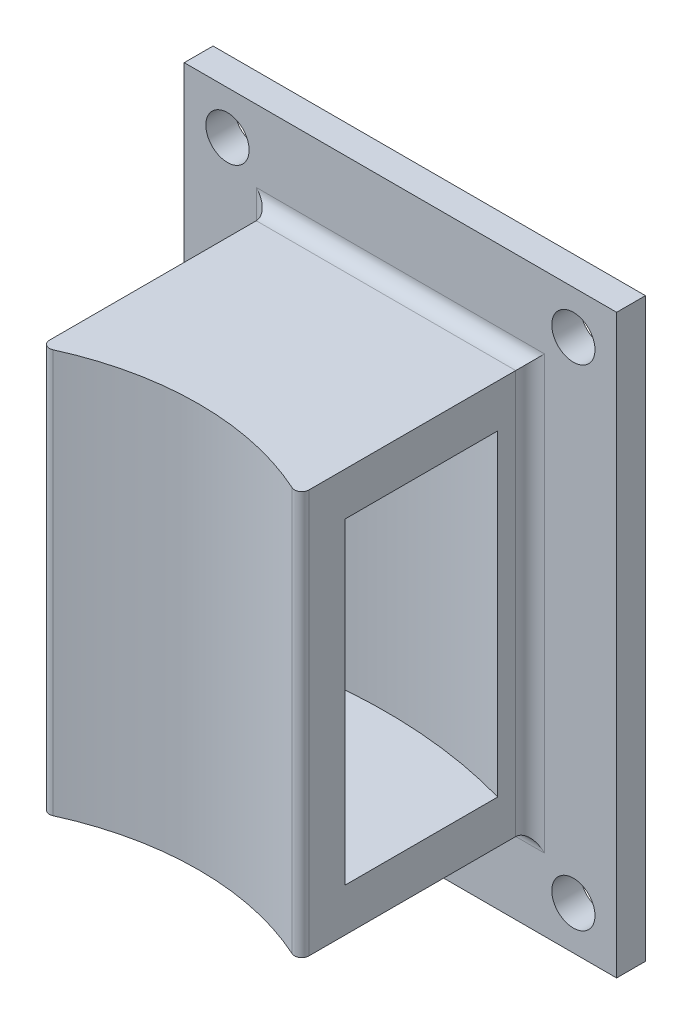
from build123d import *

# Parameters (mm, degrees)
EXTRUDE_1_DEPTH     = 11
EXTRUDE_1_2_DEPTH   = 11
EXTRUDE_2_DEPTH     = 3
SKETCH_5_W          = 30
SKETCH_5_H          = 40
SKETCH_5_W_2        = 18
SKETCH_5_H_2        = 28
EXTRUDE_3_DEPTH     = 2
SKETCH_6_R          = 1.5
CUT_EXTRUDE_1_DEPTH = 30.757035559
FILLET_1_R          = 1
FILLET_2_R          = 0.5


with BuildPart() as part:
    # 草图1 → 凸台-拉伸1 (new, symmetric)
    with BuildSketch(Plane(origin=(0, 0, 0), x_dir=(1, 0, 0), z_dir=(0, 1, 0))):
        with BuildLine():
            Line((-9, 36), (-9, 31.749015733))
            ThreePointArc((-9, 31.749015733), (0, 33), (9, 31.749015733))
            Line((9, 31.749015733), (9, 36))
            Line((9, 36), (-9, 36))
        make_face()
    extrude(amount=EXTRUDE_1_DEPTH, both=True)



with BuildPart() as body_2:
    # 草图1 → Extrude 1 2 (new, symmetric)
    with BuildSketch(Plane(origin=(0, 0, 0), x_dir=(1, 0, 0), z_dir=(0, 1, 0))):
        with BuildLine():
            Line((-9, 21.166010489), (-9, 17.860571099))
            ThreePointArc((-9, 17.860571099), (0, 20), (9, 17.860571099))
            Line((9, 17.860571099), (9, 21.166010489))
            ThreePointArc((9, 21.166010489), (0, 23), (-9, 21.166010489))
        make_face()
    extrude(amount=EXTRUDE_1_2_DEPTH, both=True)


with BuildPart() as part_1:
    add(part.part)

    add(body_2.part)  # 凸台-拉伸2 merges body 2
    # 草图2 → 凸台-拉伸2 (add)
    with BuildSketch(Plane(origin=(0, 11, 0), x_dir=(1, 0, 0), z_dir=(0, 1, 0))):
        with BuildLine():
            Line((-9, 36), (-9, 17.860571099))
            ThreePointArc((-9, 17.860571099), (0, 20), (9, 17.860571099))
            Line((9, 17.860571099), (9, 36))
            Line((9, 36), (-9, 36))
        make_face()
    extrude_2 = extrude(amount=EXTRUDE_2_DEPTH)

    # 镜向1: 凸台-拉伸2 across plane
    add(extrude_2.mirror(Plane.ZX))

    # 草图5 → 凸台-拉伸3 (add)
    with BuildSketch(Plane(origin=(0, 0, -36), x_dir=(-1, 0, 0), z_dir=(0, 0, -1))):
        Rectangle(SKETCH_5_W, SKETCH_5_H)
        Rectangle(SKETCH_5_W_2, SKETCH_5_H_2, mode=Mode.SUBTRACT)
    extrude(amount=-EXTRUDE_3_DEPTH)

    # 草图6 → 切除-拉伸1 (cut, through all)
    with BuildSketch(Plane.XY.offset(-34)):
        with Locations((12, 17)):
            Circle(SKETCH_6_R)
        with Locations((-12, 17)):
            Circle(SKETCH_6_R)
        with Locations((12, -17)):
            Circle(SKETCH_6_R)
        with Locations((-12, -17)):
            Circle(SKETCH_6_R)
    extrude(amount=-CUT_EXTRUDE_1_DEPTH, mode=Mode.SUBTRACT)

    # 圆角1
    fillet_1_edges = [part_1.edges().sort_by_distance(p)[0] for p in [
        (9, 0, -34),
        (0, 14, -34),
        (-9, 0, -34),
        (0, -14, -34),
    ]]
    fillet(fillet_1_edges, radius=FILLET_1_R)

    # 圆角2
    fillet_2_edges = [part_1.edges().sort_by_distance(p)[0] for p in [
        (9, 0, -17.860571099),
        (-9, 0, -17.860571099),
    ]]
    fillet(fillet_2_edges, radius=FILLET_2_R)


solid = part_1.part
